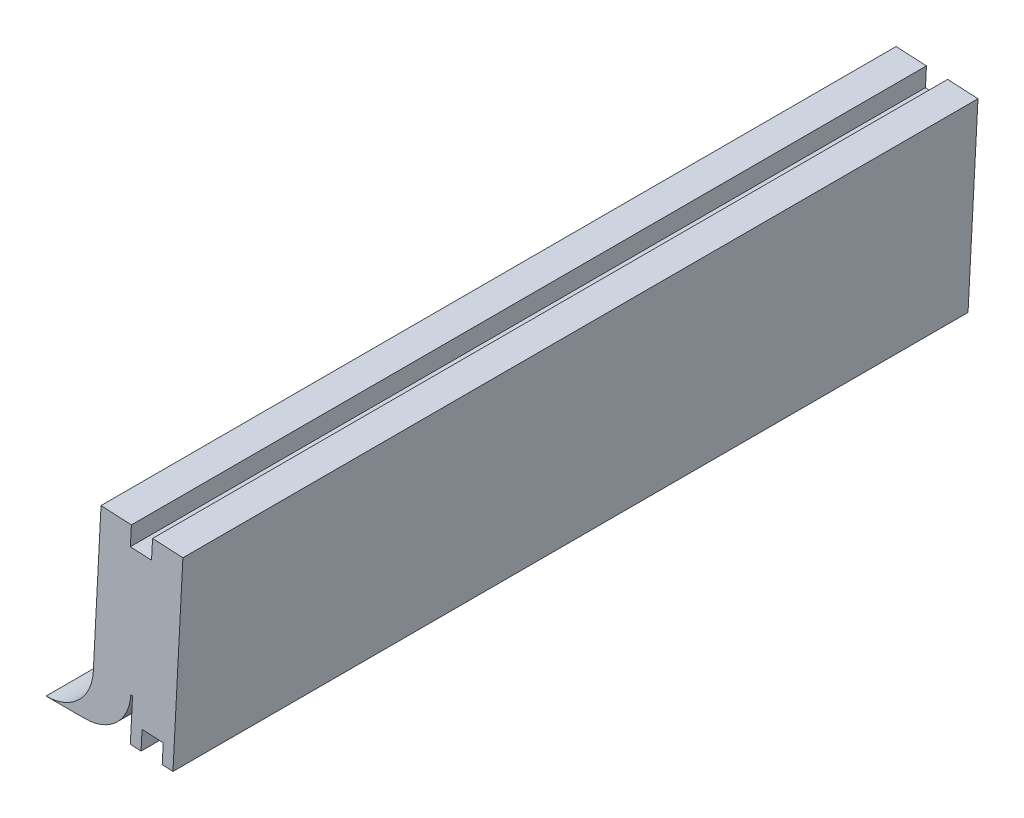
from build123d import *

# Parameters (mm, degrees)
BOSS_EXTRUDE1_DEPTH = 225
FILL_START          = -23.540933104
FILL_PATTERN1_DEPTH = 23.540933104
BOSS_EXTRUDE2_START = -225
BOSS_EXTRUDE2_DEPTH = 225


# Read off the part's stored shape, not the designer's step: Fill Pattern1
with BuildPart() as part:
    # Sketch2 → Boss-Extrude1 (new body)
    with BuildSketch(Plane.XY):
        with BuildLine():
            Line((0, 0), (2.81879464, 53.785805815))
            Line((2.81879464, 53.785805815), (-5.769419359, 54.235895039))
            Line((-5.769419359, 54.235895039), (-6.057267119, 48.743432598))
            Line((-6.057267119, 48.743432598), (-12.049044327, 49.057448335))
            Line((-12.049044327, 49.057448335), (-11.761196568, 54.549910776))
            Line((-11.761196568, 54.549910776), (-20.349410567, 55))
            Line((-20.349410567, 55), (-22.538969208, 13.220732271))
            ThreePointArc((-22.538969208, 13.220732271), (-26.69665366, 4.202017513), (-35.920604974, 0.522034085))
            Line((-35.920604974, 0.522034085), (-24.906444833, 0.522034085))
            ThreePointArc((-24.906444833, 0.522034085), (-15.957835349, 4.092167262), (-11.924260881, 12.841666654))
            Line((-11.924260881, 12.841666654), (-11.424946114, 12.815498675))
            Line((-11.424946114, 12.815498675), (-12.06344478, 0.632218351))
            Line((-12.06344478, 0.632218351), (-9.027610994, 0.473117044))
            Line((-9.027610994, 0.473117044), (-8.739763235, 5.965579486))
            Line((-8.739763235, 5.965579486), (-2.747986026, 5.651563748))
            Line((-2.747986026, 5.651563748), (-3.035833786, 0.159101307))
            Line((-3.035833786, 0.159101307), (0, 0))
        make_face()
    extrude(amount=BOSS_EXTRUDE1_DEPTH)

    # Fill Pattern1 outline → Fill Pattern1 (cut)
    with BuildSketch(Plane(origin=(0, 0, 0), x_dir=(0.052335956242944, 0.9986295347545739, 0), z_dir=(0.9986295347545739, -0.052335956242943994, 0)).offset(FILL_START)):
        Polygon((9.019555237, 187.60734985), (17.679809275, 182.60734985), (26.340063313, 187.60734985), (26.340063313, 197.60734985), (17.679809275, 202.60734985), (9.019555237, 197.60734985), align=None)
        Polygon((9.019555237, 155.56440991), (17.679809275, 150.56440991), (26.340063313, 155.56440991), (26.340063313, 165.56440991), (17.679809275, 170.56440991), (9.019555237, 165.56440991), align=None)
        Polygon((9.019555237, 123.52146997), (17.679809275, 118.52146997), (26.340063313, 123.52146997), (26.340063313, 133.52146997), (17.679809275, 138.52146997), (9.019555237, 133.52146997), align=None)
        Polygon((9.019555237, 91.47853003), (17.679809275, 86.47853003), (26.340063313, 91.47853003), (26.340063313, 101.47853003), (17.679809275, 106.47853003), (9.019555237, 101.47853003), align=None)
        Polygon((9.019555237, 59.43559009), (17.679809275, 54.43559009), (26.340063313, 59.43559009), (26.340063313, 69.43559009), (17.679809275, 74.43559009), (9.019555237, 69.43559009), align=None)
        Polygon((17.679809275, 22.39265015), (26.340063313, 27.39265015), (26.340063313, 37.39265015), (17.679809275, 42.39265015), (9.019555237, 37.39265015), (9.019555237, 27.39265015), align=None)
        Polygon((36.179809275, 150.56440991), (44.840063313, 155.56440991), (44.840063313, 165.56440991), (36.179809275, 170.56440991), (27.519555237, 165.56440991), (27.519555237, 155.56440991), align=None)
        Polygon((44.840063313, 123.52146997), (44.840063313, 133.52146997), (36.179809275, 138.52146997), (27.519555237, 133.52146997), (27.519555237, 123.52146997), (36.179809275, 118.52146997), align=None)
        Polygon((44.840063313, 187.60734985), (44.840063313, 197.60734985), (36.179809275, 202.60734985), (27.519555237, 197.60734985), (27.519555237, 187.60734985), (36.179809275, 182.60734985), align=None)
        Polygon((44.840063313, 27.39265015), (44.840063313, 37.39265015), (36.179809275, 42.39265015), (27.519555237, 37.39265015), (27.519555237, 27.39265015), (36.179809275, 22.39265015), align=None)
        Polygon((44.840063313, 59.43559009), (44.840063313, 69.43559009), (36.179809275, 74.43559009), (27.519555237, 69.43559009), (27.519555237, 59.43559009), (36.179809275, 54.43559009), align=None)
        Polygon((44.840063313, 91.47853003), (44.840063313, 101.47853003), (36.179809275, 106.47853003), (27.519555237, 101.47853003), (27.519555237, 91.47853003), (36.179809275, 86.47853003), align=None)
        Polygon((26.929809275, 38.41412012), (35.590063313, 43.41412012), (35.590063313, 53.41412012), (26.929809275, 58.41412012), (18.269555237, 53.41412012), (18.269555237, 43.41412012), align=None)
        Polygon((35.590063313, 11.37118018), (35.590063313, 21.37118018), (26.929809275, 26.37118018), (18.269555237, 21.37118018), (18.269555237, 11.37118018), (26.929809275, 6.37118018), align=None)
        Polygon((35.590063313, 203.62881982), (35.590063313, 213.62881982), (26.929809275, 218.62881982), (18.269555237, 213.62881982), (18.269555237, 203.62881982), (26.929809275, 198.62881982), align=None)
        Polygon((35.590063313, 171.58587988), (35.590063313, 181.58587988), (26.929809275, 186.58587988), (18.269555237, 181.58587988), (18.269555237, 171.58587988), (26.929809275, 166.58587988), align=None)
        Polygon((35.590063313, 139.54293994), (35.590063313, 149.54293994), (26.929809275, 154.54293994), (18.269555237, 149.54293994), (18.269555237, 139.54293994), (26.929809275, 134.54293994), align=None)
        Polygon((35.590063313, 107.5), (35.590063313, 117.5), (26.929809275, 122.5), (18.269555237, 117.5), (18.269555237, 107.5), (26.929809275, 102.5), align=None)
        Polygon((35.590063313, 75.45706006), (35.590063313, 85.45706006), (26.929809275, 90.45706006), (18.269555237, 85.45706006), (18.269555237, 75.45706006), (26.929809275, 70.45706006), align=None)
    extrude(amount=FILL_PATTERN1_DEPTH, mode=Mode.SUBTRACT)

    # Sketch3 → Boss-Extrude2 (add)
    with BuildSketch(Plane.XY.offset(225).offset(BOSS_EXTRUDE2_START)):
        Polygon((2.81879464, 53.785805815), (0, 0), (-0.998629535, 0.052335956), (1.820165105, 53.838141771), align=None)
        with BuildLine():
            Line((-20.349410567, 55), (-19.350781032, 54.947664044))
            Line((-19.350781032, 54.947664044), (-21.854723289, 7.169599567))
            Line((-21.854723289, 7.169599567), (-24.346296006, 7.169599567))
            ThreePointArc((-24.346296006, 7.169599567), (-23.081062687, 10.08717374), (-22.538969208, 13.220732271))
            Line((-22.538969208, 13.220732271), (-20.349410567, 55))
        make_face()
    extrude(amount=BOSS_EXTRUDE2_DEPTH)


solid = part.part
